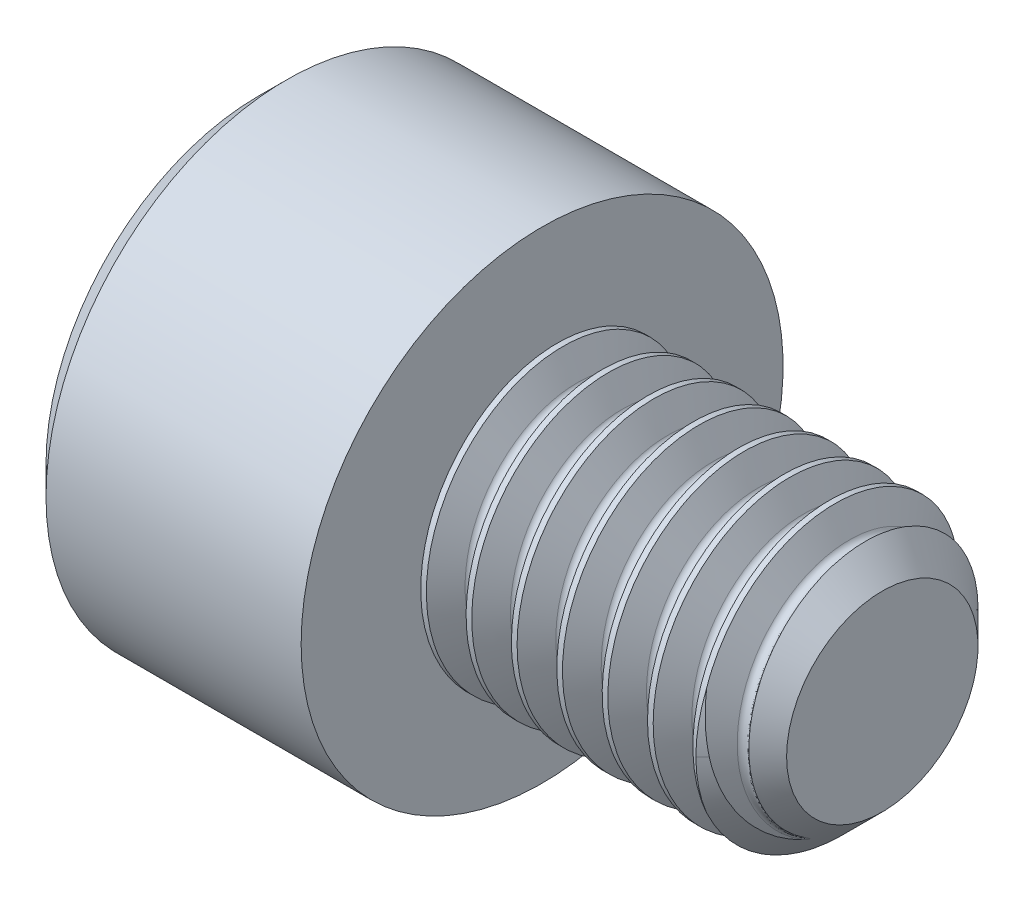
from build123d import *

# Parameters (mm, degrees)
CHAMFER1_SIZE      = 0.8
CHAMFER2_SIZE      = 0.5
CUT_EXTRUDE1_DEPTH = 2.5
CHAMFER3_SIZE      = 0.4
CUT_SWEEP1_PITCH   = 0.8
CUT_SWEEP1_TO      = 6


with BuildPart() as part:
    # Sketch1 → Revolve1 (revolve)
    with BuildSketch(Plane.XY, mode=Mode.PRIVATE) as revolve1_sk:
        Polygon((0, 0), (0, 4.25), (5, 4.25), (5, 2.488), (11, 2.488), (11, 0), align=None)
    revolve(revolve1_sk.sketch.rotate(Axis((-88.705490849, 0, 0), (1, 0, 0)), 90), axis=Axis((-88.705490849, 0, 0), (1, 0, 0)))

    # Chamfer1
    chamfer1_edges = [part.edges().sort_by_distance(p)[0] for p in [
        (11, 0, -2.488),
    ]]
    chamfer(chamfer1_edges, length=CHAMFER1_SIZE)

    # Chamfer2
    chamfer2_edges = [part.edges().sort_by_distance(p)[0] for p in [
        (0, 0, -4.25),
    ]]
    chamfer(chamfer2_edges, length=CHAMFER2_SIZE)

    # Sketch3 → Cut-Extrude1 (cut)
    with BuildSketch(Plane(origin=(0, 0, 0), x_dir=(0, 0, -1), z_dir=(1, 0, 0))):
        Polygon((-2.309401077, 0), (-1.154700538, -2), (1.154700538, -2), (2.309401077, 0), (1.154700538, 2), (-1.154700538, 2), align=None)
    extrude(amount=CUT_EXTRUDE1_DEPTH, mode=Mode.SUBTRACT)

    # Chamfer3
    chamfer3_edges = [part.edges().sort_by_distance(p)[0] for p in [
        (0, 1, 1.732050808),
        (0, -1, 1.732050808),
        (0, -2, 0),
        (0, -1, -1.732050808),
        (0, 1, -1.732050808),
        (0, 2, 0),
    ]]
    chamfer(chamfer3_edges, length=CHAMFER3_SIZE)

    # Cut-Sweep1: arcs per turn and ends read off the stored shape
    # Cut-Sweep1: the profile of Sketch8 screwed along a right-hand helix through 9 turns, 8 arcs to a turn; built about Z, then put on its axis
    cut_sweep1_z = Axis((0, 0, 0), (0, 0, 1))
    cut_sweep1_corners = [(2.054875, 0, -0.100025934), (2.7911875, 0, -0.525136154), (2.7911875, 0, 0.525136154), (2.054875, 0, 0.100025934), (1.997125, 0, 0)]
    with BuildLine(mode=Mode.PRIVATE) as cut_sweep1_profile:
        Line(cut_sweep1_corners[0], cut_sweep1_corners[1])
        Line(cut_sweep1_corners[1], cut_sweep1_corners[2])
        Line(cut_sweep1_corners[2], cut_sweep1_corners[3])
        ThreePointArc((2.054875, 0, 0.100025934), (2.012599066, 0, 0.05775), (1.997125, 0, 0))
        ThreePointArc((1.997125, 0, 0), (2.012599066, 0, -0.05775), (2.054875, 0, -0.100025934))
    cut_sweep1_cap = Face(cut_sweep1_profile.wire())
    cut_sweep1_arcs = [((2.054875, 0, 0.100025934), (1.997125, 0, 0.066683956), (1.997125, 0, 0), (1, 0.8660254037844388, 1)), ((1.997125, 0, 0), (1.997125, 0, -0.066683956), (2.054875, 0, -0.100025934), (1, 0.8660254037844388, 1))]  # start, shoulder, end, weights
    cut_sweep1_turn_angles = [0, 22.5, 45, 67.5, 90, 112.5, 135, 157.5, 180, 202.5, 225, 247.5, 270, 292.5, 315, 337.5, 360]
    cut_sweep1_turn_weights = [1, 0.9238795325112867, 1, 0.9238795325112867, 1, 0.9238795325112867, 1, 0.9238795325112867, 1, 0.9238795325112867, 1, 0.9238795325112867, 1, 0.9238795325112867, 1, 0.9238795325112867, 1]
    cut_sweep1_turn_rails = [Edge.make_bspline([Vector(p[0], p[1], 0).rotate(cut_sweep1_z, cut_sweep1_turn_angles[k]) / cut_sweep1_turn_weights[k] + Vector(0, 0, p[2] + CUT_SWEEP1_PITCH * cut_sweep1_turn_angles[k] / 360) for k in range(17)], [0, 0, 0, 1, 1, 2, 2, 3, 3, 4, 4, 5, 5, 6, 6, 7, 7, 8, 8, 8], 2, cut_sweep1_turn_weights) for p in cut_sweep1_corners]
    cut_sweep1_turn_sides = [*[Face.make_surface_from_curves(cut_sweep1_turn_rails[p[0]], cut_sweep1_turn_rails[p[1]]) for p in [(0, 1), (1, 2), (2, 3)]], *[Face.make_bezier_surface([[Vector(p[j][0], p[j][1], 0).rotate(cut_sweep1_z, cut_sweep1_turn_angles[2 * i + k]) / cut_sweep1_turn_weights[2 * i + k] + Vector(0, 0, p[j][2] + CUT_SWEEP1_PITCH * cut_sweep1_turn_angles[2 * i + k] / 360) for k in range(3)] for j in range(3)], [[p[3][j] * cut_sweep1_turn_weights[2 * i + k] for k in range(3)] for j in range(3)]) for p in cut_sweep1_arcs for i in range(8)]]
    cut_sweep1_turn = Solid(Shell([*cut_sweep1_turn_sides, cut_sweep1_cap, cut_sweep1_cap.rotate(cut_sweep1_z, 360).moved(Location((0, 0, CUT_SWEEP1_PITCH * 360 / 360)))]))
    cut_sweep1_each = [*[cut_sweep1_turn.moved(Location((0, 0, CUT_SWEEP1_PITCH * i))) for i in range(9)]]
    add(Plane(origin=(11, 0, 0), x_dir=(0, 0, -1), z_dir=(-1, 0, 0)) * split(Compound([cut_sweep1_each[i] for i in range(0, 9, 2)]), bisect_by=Plane.XY.offset(CUT_SWEEP1_TO), keep=Keep.BOTTOM, mode=Mode.PRIVATE), mode=Mode.SUBTRACT)
    add(Plane(origin=(11, 0, 0), x_dir=(0, 0, -1), z_dir=(-1, 0, 0)) * split(Compound([cut_sweep1_each[i] for i in range(1, 9, 2)]), bisect_by=Plane.XY.offset(CUT_SWEEP1_TO), keep=Keep.BOTTOM, mode=Mode.PRIVATE), mode=Mode.SUBTRACT)


solid = part.part
